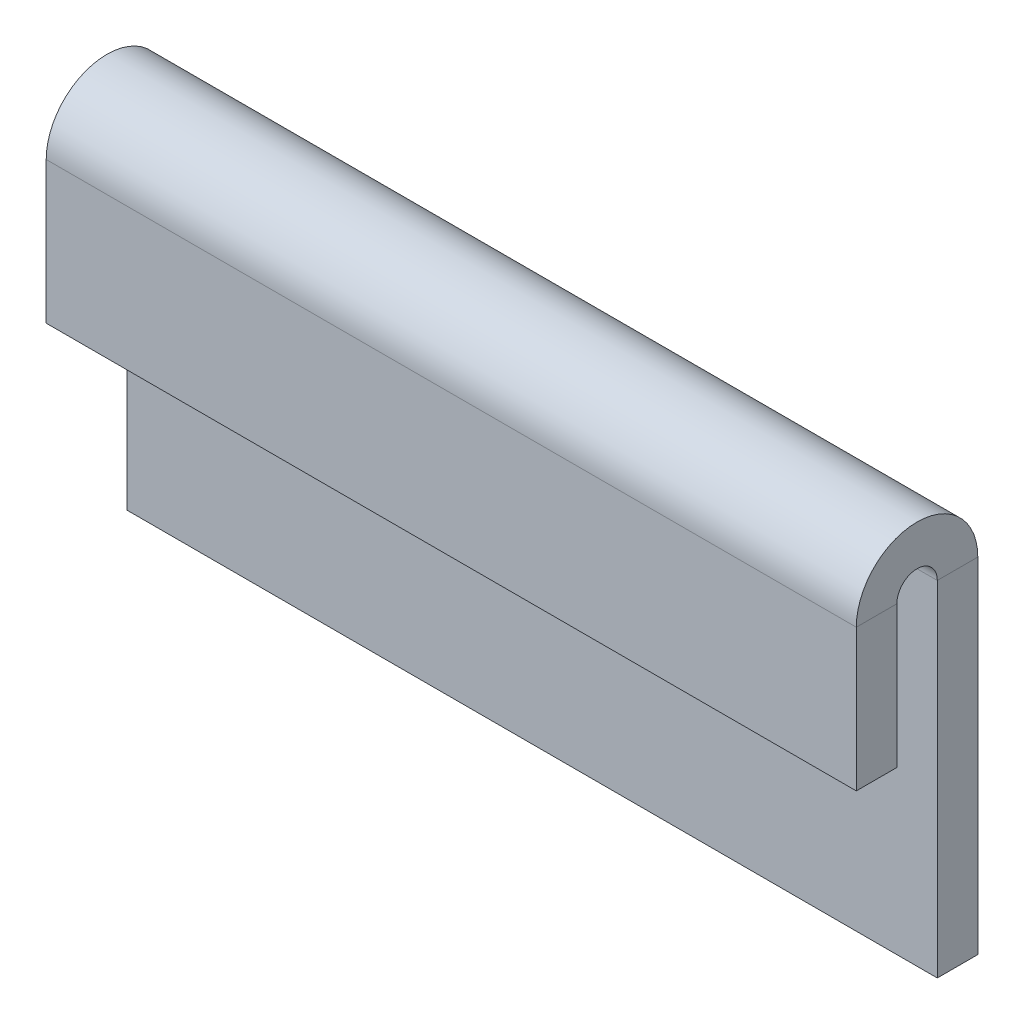
from build123d import *

# Parameters (mm, degrees)
SKETCH_1_W       = 20
SKETCH_1_H       = 10
BASEPLATE_DEPTH  = 1
HEM_OPEN_DEPTH   = 20
HEM_OPEN_2_DEPTH = 20


# Read off the part's stored shape, not the designer's step: Hem_open
# Sheet-metal steps are written as plain solids
with BuildPart() as part:
    # Sketch 1 → BasePlate (new body)
    with BuildSketch(Plane.XY):
        with Locations((10, 5)):
            Rectangle(SKETCH_1_W, SKETCH_1_H)
    extrude(amount=-BASEPLATE_DEPTH)

    # Hem_open outline → Hem_open (cut)
    with BuildSketch(Plane.YZ):
        with BuildLine():
            Line((10, 0), (9.914213562, 0))
            ThreePointArc((9.914213562, 0), (9.366025404, -0.724744871), (8.5, -1))
            Line((8.5, -1), (10, -1))
            Line((10, -1), (10, 0))
        make_face()
    extrude(amount=HEM_OPEN_DEPTH, mode=Mode.SUBTRACT)

    # Hem_open 2 outline → Hem_open 2 (add)
    with BuildSketch(Plane.YZ):
        with BuildLine():
            Line((5, 2), (5, 1))
            Line((5, 1), (8.5, 1))
            ThreePointArc((8.5, 1), (9, 0.5), (8.5, 0))
            Line((8.5, 0), (9.914213562, 0))
            ThreePointArc((9.914213562, 0), (9.724744871, 1.366025404), (8.5, 2))
            Line((8.5, 2), (5, 2))
        make_face()
    extrude(amount=HEM_OPEN_2_DEPTH)


solid = part.part
